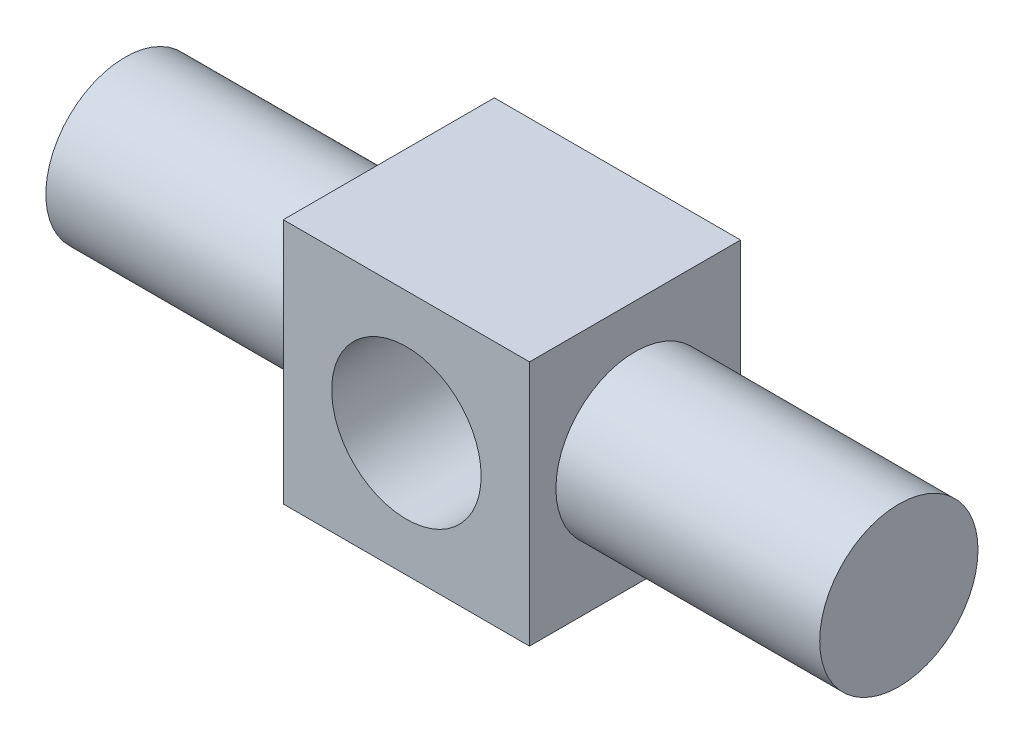
from build123d import *

# Parameters (mm, degrees)
SKETCH_1_W          = 14
SKETCH_1_H          = 14
EXTRUDE_1_DEPTH     = 6
SKETCH_2_R          = 4.5
EXTRUDE_2_DEPTH     = 15
HOLE_WIZARD_M10_1_D = 8.5


with BuildPart() as part:
    # 草图1 → 凸台-拉伸1 (new, symmetric)
    with BuildSketch(Plane.XY):
        Rectangle(SKETCH_1_W, SKETCH_1_H)
    extrude(amount=EXTRUDE_1_DEPTH, both=True)

    # 草图2 → 凸台-拉伸2 (add)
    with BuildSketch(Plane(origin=(7, 0, 0), x_dir=(0, 0, -1), z_dir=(1, 0, 0))):
        Circle(SKETCH_2_R)
    extrude_2 = extrude(amount=EXTRUDE_2_DEPTH)

    # 镜向1: 凸台-拉伸2 across plane
    add(extrude_2.mirror(Plane(origin=(0, 0, 0), x_dir=(0, 0, 1), z_dir=(1, 0, 0))))

    # M10 螺纹孔1 (through all)
    with Locations(Plane.XY.offset(6)):
        with Locations((0, 0)):
            Hole(HOLE_WIZARD_M10_1_D / 2)


solid = part.part
